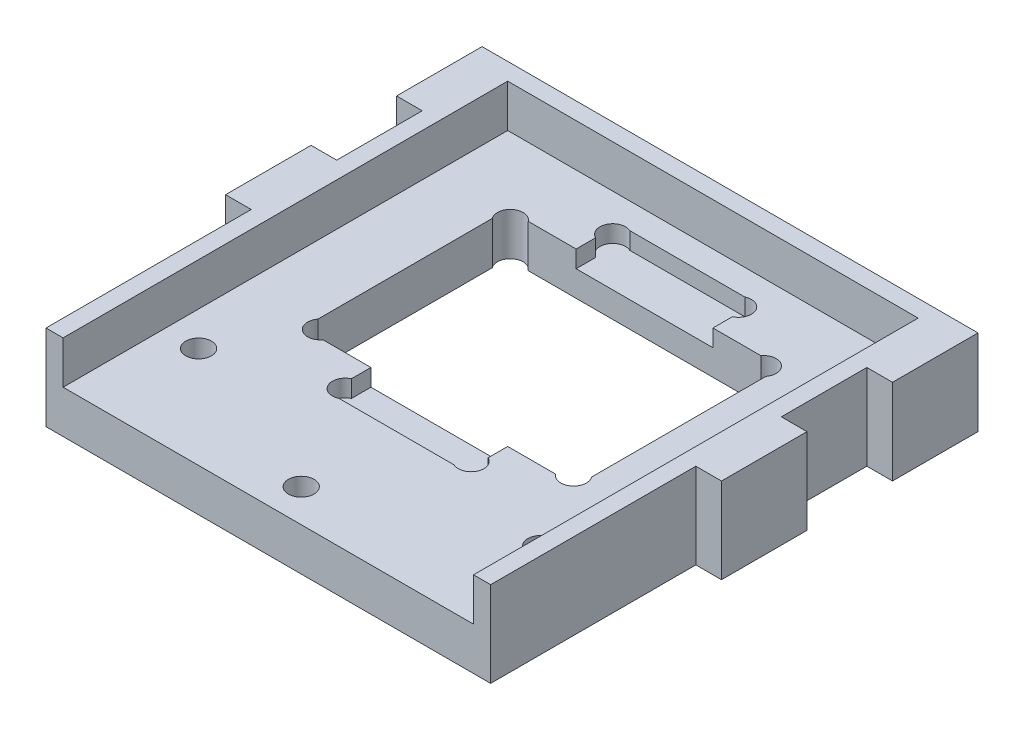
from build123d import *

# Parameters (mm, degrees)
SKETCH1_W               = 52
SKETCH1_H               = 54
SKETCH1_W_2             = 32
SKETCH1_H_2             = 24
BOSS_EXTRUDE1_DEPTH     = 10
SKETCH2_W               = 48
SKETCH2_H               = 52
CUT_EXTRUDE1_DEPTH      = 5
SKETCH3_W               = 16
SKETCH3_H               = 5
CUT_EXTRUDE2_DEPTH      = 2
SKETCH4_R               = 1.5
CUT_EXTRUDE3_DEPTH      = 5
SKETCH6_W               = 3
SKETCH6_H               = 10
BOSS_EXTRUDE2_DEPTH     = 10
LPATTERN1_COUNT         = 2
LPATTERN1_PITCH         = 20
MIRROR1_COPY_1_SKETCH_W = 3
MIRROR1_COPY_1_SKETCH_H = 10
MIRROR1_COPY_1_DEPTH    = 10
MIRROR1_COPY_2_SKETCH_W = 3
MIRROR1_COPY_2_SKETCH_H = 10
MIRROR1_COPY_2_DEPTH    = 10
SKETCH9_R               = 1.5
CUT_EXTRUDE8_DEPTH      = 2
SKETCH9_2_R             = 1.5
CUT_EXTRUDE9_DEPTH      = 8


with BuildPart() as part:
    # Sketch1 → Boss-Extrude1 (new body)
    with BuildSketch(Plane(origin=(0, 0, 0), x_dir=(1, 0, 0), z_dir=(0, 1, 0))):
        Rectangle(SKETCH1_W, SKETCH1_H)
        with Locations((0, 5)):
            Rectangle(SKETCH1_W_2, SKETCH1_H_2, mode=Mode.SUBTRACT)
    extrude(amount=BOSS_EXTRUDE1_DEPTH)

    # Sketch2 → Cut-Extrude1 (cut)
    with BuildSketch(Plane(origin=(0, 10, 0), x_dir=(-1, 0, 0), z_dir=(0, 1, 0))):
        with Locations((0, 1)):
            Rectangle(SKETCH2_W, SKETCH2_H)
    extrude(amount=-CUT_EXTRUDE1_DEPTH, mode=Mode.SUBTRACT)

    # Sketch3 → Cut-Extrude2 (cut)
    with BuildSketch(Plane(origin=(0, 5, 0), x_dir=(-1, 0, 0), z_dir=(0, 1, 0))):
        with Locations((0, -19.5)):
            Rectangle(SKETCH3_W, SKETCH3_H)
        with Locations((0, 9.5)):
            Rectangle(SKETCH3_W, SKETCH3_H)
    extrude(amount=-CUT_EXTRUDE2_DEPTH, mode=Mode.SUBTRACT)

    # Sketch4 → Cut-Extrude3 (cut)
    with BuildSketch(Plane(origin=(0, 5, 0), x_dir=(1, 0, 0), z_dir=(0, 1, 0))):
        with Locations((-20, -15.152442668)):
            Circle(SKETCH4_R)
        with Locations((0, -23.152442668)):
            Circle(SKETCH4_R)
        with Locations((20, -15.152442668)):
            Circle(SKETCH4_R)
    extrude(amount=-CUT_EXTRUDE3_DEPTH, mode=Mode.SUBTRACT)

    # Sketch6 → Boss-Extrude2 (add)
    with BuildSketch(Plane(origin=(0, 10, 0), x_dir=(1, 0, 0), z_dir=(0, 1, 0))):
        with Locations((-27.5, 22)):
            Rectangle(SKETCH6_W, SKETCH6_H)
    boss_extrude2 = extrude(amount=-BOSS_EXTRUDE2_DEPTH)

    # LPattern1: Boss-Extrude2 ×2
    with Locations(*[(0, 0, i * LPATTERN1_PITCH) for i in range(1, LPATTERN1_COUNT)]):
        add(boss_extrude2)

    # Mirror1 copy 1 sketch → Mirror1 copy 1 (add)
    with BuildSketch(Plane(origin=(0, 10, 20), x_dir=(-1, 0, 0), z_dir=(0, 1, 0))):
        with Locations((-27.5, -22)):
            Rectangle(MIRROR1_COPY_1_SKETCH_W, MIRROR1_COPY_1_SKETCH_H)
    extrude(amount=-MIRROR1_COPY_1_DEPTH)

    # Mirror1 copy 2 sketch → Mirror1 copy 2 (add)
    with BuildSketch(Plane(origin=(0, 10, 0), x_dir=(-1, 0, 0), z_dir=(0, 1, 0))):
        with Locations((-27.5, -22)):
            Rectangle(MIRROR1_COPY_2_SKETCH_W, MIRROR1_COPY_2_SKETCH_H)
    extrude(amount=-MIRROR1_COPY_2_DEPTH)

    # Sketch9 → Cut-Extrude8 (cut)
    with BuildSketch(Plane(origin=(0, 5, 0), x_dir=(1, 0, 0), z_dir=(0, 1, 0))):
        with Locations((-7.361304446, -10.642771947)):
            Circle(SKETCH9_R)
        with Locations((7.361304446, -10.642771947)):
            Circle(SKETCH9_R)
        with Locations((14.8, -6.1)):
            Circle(SKETCH9_R)
        with Locations((14.8, 16.1)):
            Circle(SKETCH9_R)
        with Locations((7.361304446, 20.642771947)):
            Circle(SKETCH9_R)
        with Locations((-7.361304446, 20.642771947)):
            Circle(SKETCH9_R)
        with Locations((-14.8, 16.1)):
            Circle(SKETCH9_R)
        with Locations((-14.8, -6.1)):
            Circle(SKETCH9_R)
    extrude(amount=-CUT_EXTRUDE8_DEPTH, mode=Mode.SUBTRACT)

    # Sketch9<2> → Cut-Extrude9 (cut)
    with BuildSketch(Plane(origin=(0, 5, 0), x_dir=(1, 0, 0), z_dir=(0, 1, 0))):
        with Locations((14.8, -6.1)):
            Circle(SKETCH9_2_R)
        with Locations((14.8, 16.1)):
            Circle(SKETCH9_2_R)
        with Locations((-14.8, 16.1)):
            Circle(SKETCH9_2_R)
        with Locations((-14.8, -6.1)):
            Circle(SKETCH9_2_R)
    extrude(amount=-CUT_EXTRUDE9_DEPTH, mode=Mode.SUBTRACT)


solid = part.part
